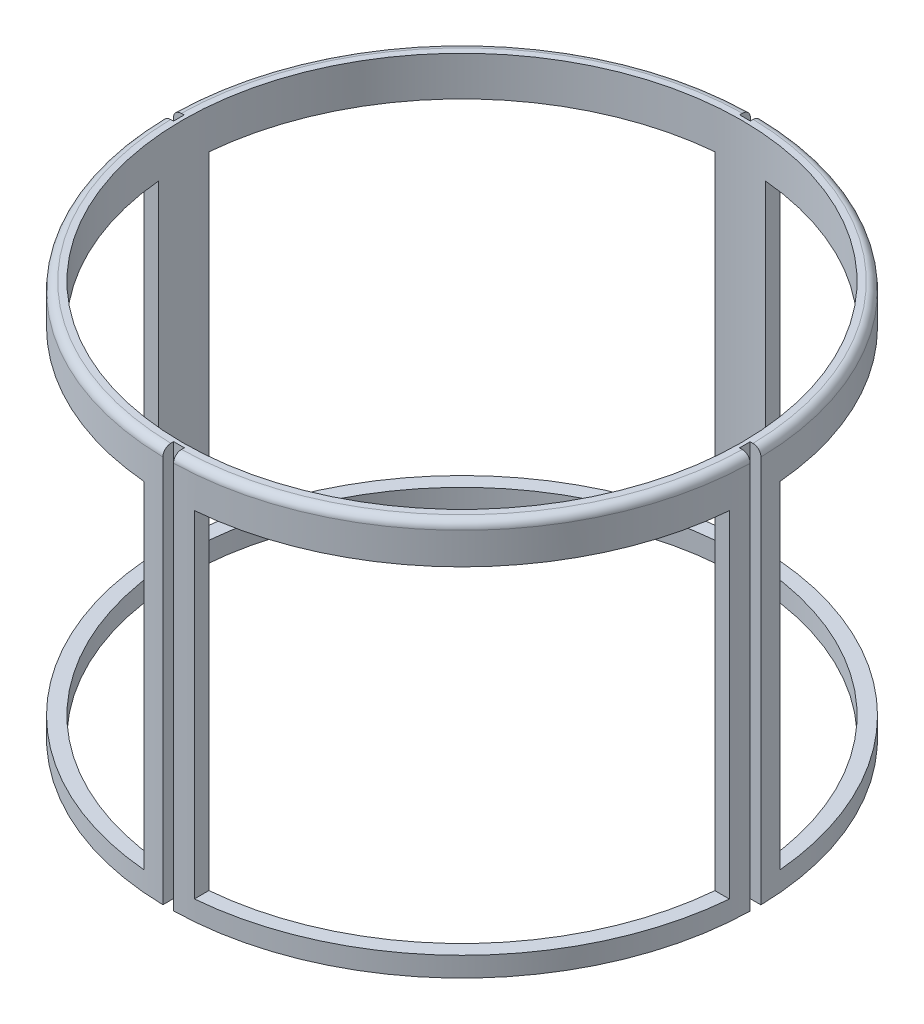
from build123d import *

# Parameters (mm, degrees)
SKETCH1_R           = 94.2975
SKETCH1_R_2         = 89.662
BOSS_EXTRUDE1_DEPTH = 127
SKETCH5_W           = 3.429
SKETCH5_H           = 5.08
SKETCH5_W_2         = 5.08
SKETCH5_H_2         = 3.429
CUT_EXTRUDE1_DEPTH  = 127
CUT_EXTRUDE2_START  = -12.7
CUT_EXTRUDE2_DEPTH  = 107.95
CIRPATTERN1_COUNT   = 4
FILLET1_R           = 2.54


with BuildPart() as part:
    # Sketch1 → Boss-Extrude1 (new body)
    with BuildSketch(Plane(origin=(0, 0, 0), x_dir=(1, 0, 0), z_dir=(0, 1, 0))):
        Circle(SKETCH1_R)
        Circle(SKETCH1_R_2, mode=Mode.SUBTRACT)
    extrude(amount=-BOSS_EXTRUDE1_DEPTH)

    # Sketch5 → Cut-Extrude1 (cut)
    with BuildSketch(Plane(origin=(0, 0, 0), x_dir=(1, 0, 0), z_dir=(0, 1, 0))):
        with Locations((0, 93.360875)):
            Rectangle(SKETCH5_W, SKETCH5_H)
        with Locations((0, -93.360875)):
            Rectangle(SKETCH5_W, SKETCH5_H)
        with Locations((-93.360875, -0.0635)):
            Rectangle(SKETCH5_W_2, SKETCH5_H_2)
        with Locations((93.360875, -0.0635)):
            Rectangle(SKETCH5_W_2, SKETCH5_H_2)
    extrude(amount=-CUT_EXTRUDE1_DEPTH, mode=Mode.SUBTRACT)

    # Sketch7 → Cut-Extrude2 (cut)
    with BuildSketch(Plane(origin=(0, 0, 0), x_dir=(1, 0, 0), z_dir=(0, 1, 0)).offset(CUT_EXTRUDE2_START)):
        with BuildLine():
            Line((89.292832075, -8.128), (93.946549283, -8.128))
            ThreePointArc((93.946549283, -8.128), (66.655864041, -66.700931742), (8.0645, -93.952021511))
            Line((8.0645, -93.952021511), (8.0645, -89.298589484))
            ThreePointArc((8.0645, -89.298589484), (63.378061476, -63.423146938), (89.292832075, -8.128))
        make_face()
    cut_extrude2 = extrude(amount=-CUT_EXTRUDE2_DEPTH, mode=Mode.SUBTRACT)

    # CirPattern1: Cut-Extrude2 ×4 about axis
    cirpattern1_axis = Axis((0, 0, 0), (0, 1, 0))
    for i in range(1, CIRPATTERN1_COUNT):
        add(cut_extrude2.rotate(cirpattern1_axis, i * 360 / CIRPATTERN1_COUNT), mode=Mode.SUBTRACT)

    # Fillet1
    fillet1_edges = [part.edges().sort_by_distance(p)[0] for p in [
        (-66.700852134, 0, -66.655943702),
        (66.700852134, 0, -66.655943702),
        (66.655943427, 0, 66.700852409),
        (-66.655943427, 0, 66.700852409),
    ]]
    fillet(fillet1_edges, radius=FILLET1_R)


solid = part.part
